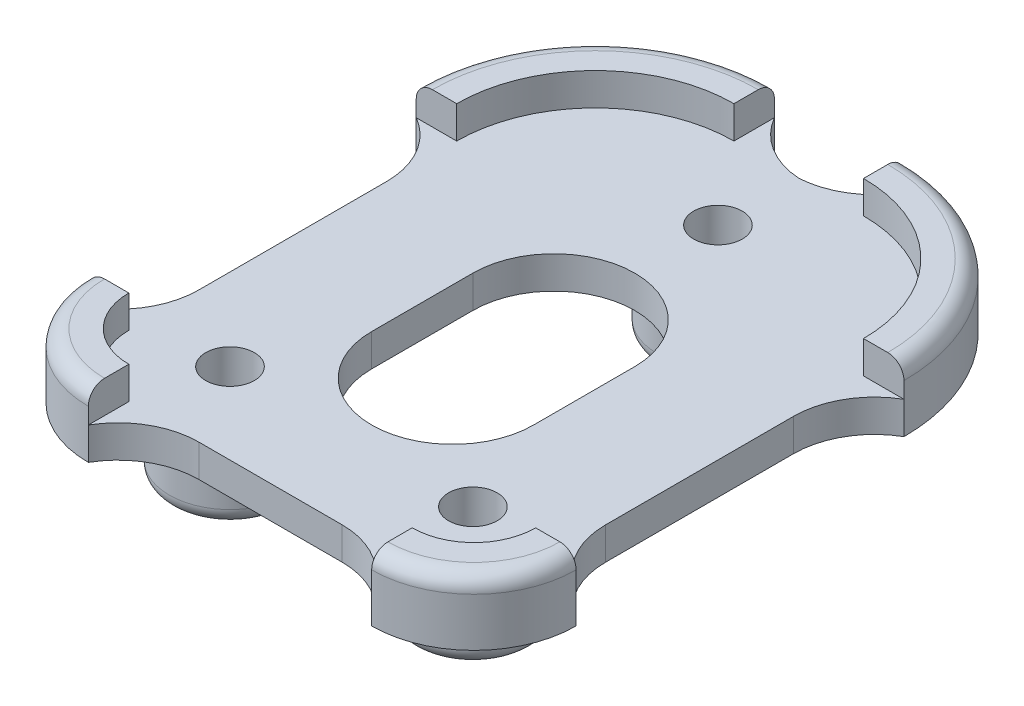
from build123d import *

# Parameters (mm, degrees)
SALIENTE_EXTRUIR1_DEPTH  = 4
SALIENTE_EXTRUIR2_START  = 4
SALIENTE_EXTRUIR2_DEPTH  = 4
REDONDEO1_R              = 10
REDONDEO3_R              = 2
CROQUIS2_R               = 7.5
CROQUIS2_R_2             = 3
SALIENTE_EXTRUIR3_DEPTH  = 8
CROQUIS2_3_R             = 7.5
CROQUIS2_3_R_2           = 3
SALIENTE_EXTRUIR4_DEPTH  = 8
REDONDEO4_R              = 2
REDONDEO5_R              = 2
REDONDEO4_OF_SIMETR_A1_R = 2
CROQUIS2_4_R             = 3
CORTAR_EXTRUIR1_DEPTH    = 77.740023923
CROQUIS5_R               = 3
CORTAR_EXTRUIR2_DEPTH    = 77.740023923


with BuildPart() as part:
    # Croquis1 → Saliente-Extruir1 (new body)
    with BuildSketch(Plane(origin=(0, 0, 0), x_dir=(1, 0, 0), z_dir=(0, 1, 0))):
        with BuildLine():
            Line((30.125, 7.5), (25.125, 7.5))
            Line((25.125, 7.5), (25.125, 48))
            Line((25.125, 48), (30.125, 48))
            ThreePointArc((30.125, 48), (23.644737534, 63.644737534), (8, 70.125))
            Line((8, 70.125), (8, 65.125))
            Line((8, 65.125), (-8, 65.125))
            Line((-8, 65.125), (-8, 70.125))
            ThreePointArc((-8, 70.125), (-23.644737534, 63.644737534), (-30.125, 48))
            Line((-30.125, 48), (-25.125, 48))
            Line((-25.125, 48), (-25.125, 7.5))
            Line((-25.125, 7.5), (-30.125, 7.5))
            ThreePointArc((-30.125, 7.5), (-26.427223112, -1.427223112), (-17.5, -5.125))
            Line((-17.5, -5.125), (-17.5, -0.125))
            Line((-17.5, -0.125), (17.5, -0.125))
            Line((17.5, -0.125), (17.5, -5.125))
            ThreePointArc((17.5, -5.125), (26.427223112, -1.427223112), (30.125, 7.5))
        make_face()
        with BuildLine():
            ThreePointArc((10, 22.375), (0, 12.375), (-10, 22.375))
            Line((-10, 22.375), (-10, 34.875))
            ThreePointArc((-10, 34.875), (0, 44.875), (10, 34.875))
            Line((10, 34.875), (10, 22.375))
        make_face(mode=Mode.SUBTRACT)
    extrude(amount=SALIENTE_EXTRUIR1_DEPTH)

    # Croquis1<3> → Saliente-Extruir2 (add)
    with BuildSketch(Plane(origin=(0, 0, 0), x_dir=(1, 0, 0), z_dir=(0, 1, 0)).offset(SALIENTE_EXTRUIR2_START)):
        with BuildLine():
            Line((-30.125, 48), (-25.125, 48))
            ThreePointArc((-25.125, 48), (-20.109203628, 60.109203628), (-8, 65.125))
            Line((-8, 65.125), (-8, 70.125))
            ThreePointArc((-8, 70.125), (-23.644737534, 63.644737534), (-30.125, 48))
        make_face()
        with BuildLine():
            Line((-17.5, -5.125), (-17.5, -0.125))
            ThreePointArc((-17.5, -0.125), (-22.891689207, 2.108310793), (-25.125, 7.5))
            Line((-25.125, 7.5), (-30.125, 7.5))
            ThreePointArc((-30.125, 7.5), (-26.427223112, -1.427223112), (-17.5, -5.125))
        make_face()
        with BuildLine():
            ThreePointArc((25.125, 7.5), (22.891689207, 2.108310793), (17.5, -0.125))
            Line((17.5, -0.125), (17.5, -5.125))
            ThreePointArc((17.5, -5.125), (26.427223112, -1.427223112), (30.125, 7.5))
            Line((30.125, 7.5), (25.125, 7.5))
        make_face()
        with BuildLine():
            ThreePointArc((8, 65.125), (20.109203628, 60.109203628), (25.125, 48))
            Line((25.125, 48), (30.125, 48))
            ThreePointArc((30.125, 48), (23.644737534, 63.644737534), (8, 70.125))
            Line((8, 70.125), (8, 65.125))
        make_face()
    extrude(amount=SALIENTE_EXTRUIR2_DEPTH)

    # Redondeo1
    # the kernel refuses this fillet: 10 mm, written as the material it adds along each edge
    with BuildSketch(Plane(origin=(8, 0, -65.125), x_dir=(-1, 0, 0), z_dir=(0, 1, 0)), Plane(origin=(-17.5, 0, 0.125), x_dir=(1, 0, 0), z_dir=(0, 1, 0)), Plane(origin=(-25.125, 0, -48), x_dir=(0, 0, 1), z_dir=(0, 1, 0))) as redondeo1_piece_1:
        with BuildLine():
            CenterArc((8.660254038, -10), REDONDEO1_R, 90, 60)
            Line((0, -5), (-0.173205081, -4.9))
            ThreePointArc((-0.173205081, -4.9), (-0.2, -2.5), (-0.2, 0))
            Line((-0.2, 0), (0, 0.2))
            Line((0, 0.2), (8.660254038, 0.2))
            Line((8.660254038, 0.2), (8.660254038, 0))
        make_face()
    extrude(amount=4)
    with BuildSketch(Plane(origin=(-8, 0, -65.125), x_dir=(0, 0, -1), z_dir=(0, 1, 0)), Plane(origin=(17.5, 0, 0.125), x_dir=(0, 0, 1), z_dir=(0, 1, 0)), Plane(origin=(25.125, 0, -48), x_dir=(1, 0, 0), z_dir=(0, 1, 0)), Plane(origin=(-25.125, 0, -7.5), x_dir=(-1, 0, 0), z_dir=(0, 1, 0))) as redondeo1_piece_2:
        with BuildLine():
            CenterArc((10, -8.660254038), REDONDEO1_R, 120, 60)
            Line((0, -8.660254038), (-0.2, -8.660254038))
            Line((-0.2, -8.660254038), (-0.2, 0))
            Line((-0.2, 0), (0, 0.2))
            ThreePointArc((0, 0.2), (2.5, 0.2), (4.9, 0.173205081))
            Line((4.9, 0.173205081), (5, 0))
        make_face()
    extrude(amount=4)
    with BuildSketch(Plane(origin=(25.125, 0, -7.5), x_dir=(1, 0, 0), z_dir=(0, 1, 0))) as redondeo1_piece_3:
        with BuildLine():
            CenterArc((10, 8.660254038), REDONDEO1_R, 180, 60)
            Line((0, 8.660254038), (-0.2, 8.660254038))
            Line((-0.2, 8.660254038), (-0.2, 0))
            Line((-0.2, 0), (0, -0.2))
            ThreePointArc((0, -0.2), (2.5, -0.2), (4.9, -0.173205081))
            Line((4.9, -0.173205081), (5, 0))
        make_face()
    extrude(amount=4)

    # Redondeo3
    redondeo3_edges = [part.edges().sort_by_distance(p)[0] for p in [
        (-23.644737534, 8, -63.644737534),
        (-26.427223112, 8, 1.427223112),
        (26.427223112, 8, 1.427223112),
        (23.644737534, 8, -63.644737534),
    ]]
    fillet(redondeo3_edges, radius=REDONDEO3_R)

    # Croquis2 → Saliente-Extruir3 (add)
    with BuildSketch(Plane.XZ):
        with Locations(Location((-15, -9.875, 0), (0, 0, 90))):
            Circle(CROQUIS2_R)
        with Locations(Location((-15, -9.875, 0), (0, 0, 270))):
            Circle(CROQUIS2_R_2, mode=Mode.SUBTRACT)
    saliente_extruir3 = extrude(amount=SALIENTE_EXTRUIR3_DEPTH)

    # Croquis2<3> → Saliente-Extruir4 (add)
    with BuildSketch(Plane.XZ):
        with Locations(Location((0, -55.146820577, 0), (0, 0, 90))):
            Circle(CROQUIS2_3_R)
        with Locations(Location((0, -55.146820577, 0), (0, 0, 270))):
            Circle(CROQUIS2_3_R_2, mode=Mode.SUBTRACT)
    extrude(amount=SALIENTE_EXTRUIR4_DEPTH)

    # Croquis3 → Cortar-Revolución1 (revolve, cut)
    with BuildSketch(Plane.XY.offset(-9.875)):
        with BuildLine():
            Line((-9.875, -5.5), (-20.125, -5.5))
            ThreePointArc((-20.125, -5.5), (-15, -10.625), (-9.875, -5.5))
        make_face()
    cortar_revoluci_n1 = revolve(axis=Axis((-9.875, -5.5, -9.875), (-1, 0, 0)), mode=Mode.SUBTRACT)

    # Croquis4 → Cortar-Revolución2 (revolve, cut)
    with BuildSketch(Plane.XY.offset(-55.146820577)):
        with BuildLine():
            Line((5.125, -5.5), (-5.125, -5.5))
            ThreePointArc((-5.125, -5.5), (0, -10.625), (5.125, -5.5))
        make_face()
    revolve(axis=Axis((5.125, -5.5, -55.146820577), (-1, 0, 0)), mode=Mode.SUBTRACT)

    # Redondeo4
    redondeo4_edges = [part.edges().sort_by_distance(p)[0] for p in [
        (-15, 0, -17.375),
        (-15, -8, -17.375),
    ]]
    fillet(redondeo4_edges, radius=REDONDEO4_R)

    # Redondeo5
    redondeo5_edges = [part.edges().sort_by_distance(p)[0] for p in [
        (0, 0, -62.646820577),
        (0, -8, -62.646820577),
    ]]
    fillet(redondeo5_edges, radius=REDONDEO5_R)

    # Simetría1: Saliente-Extruir3, Cortar-Revolución1 across plane
    add(saliente_extruir3.mirror(Plane(origin=(0, 0, 0), x_dir=(0, 0, 1), z_dir=(1, 0, 0))))
    add(cortar_revoluci_n1.mirror(Plane(origin=(0, 0, 0), x_dir=(0, 0, 1), z_dir=(1, 0, 0))), mode=Mode.SUBTRACT)

    # Redondeo4 of Simetría1
    redondeo4_of_simetr_a1_edges = [part.edges().sort_by_distance(p)[0] for p in [
        (15, 0, -17.375),
        (15, -8, -17.375),
    ]]
    fillet(redondeo4_of_simetr_a1_edges, radius=REDONDEO4_OF_SIMETR_A1_R)

    # Croquis2<4> → Cortar-Extruir1 (cut, through all)
    with BuildSketch(Plane.XZ):
        with Locations(Location((0, -55.146820577, 0), (0, 0, 90))):
            Circle(CROQUIS2_4_R)
        with Locations(Location((-15, -9.875, 0), (0, 0, 90))):
            Circle(CROQUIS2_4_R)
    extrude(amount=-CORTAR_EXTRUIR1_DEPTH, mode=Mode.SUBTRACT)

    # Croquis5 → Cortar-Extruir2 (cut, through all)
    with BuildSketch(Plane.XZ):
        with Locations(Location((15, -9.875, 0), (0, 0, 90))):
            Circle(CROQUIS5_R)
    extrude(amount=-CORTAR_EXTRUIR2_DEPTH, mode=Mode.SUBTRACT)


solid = part.part
